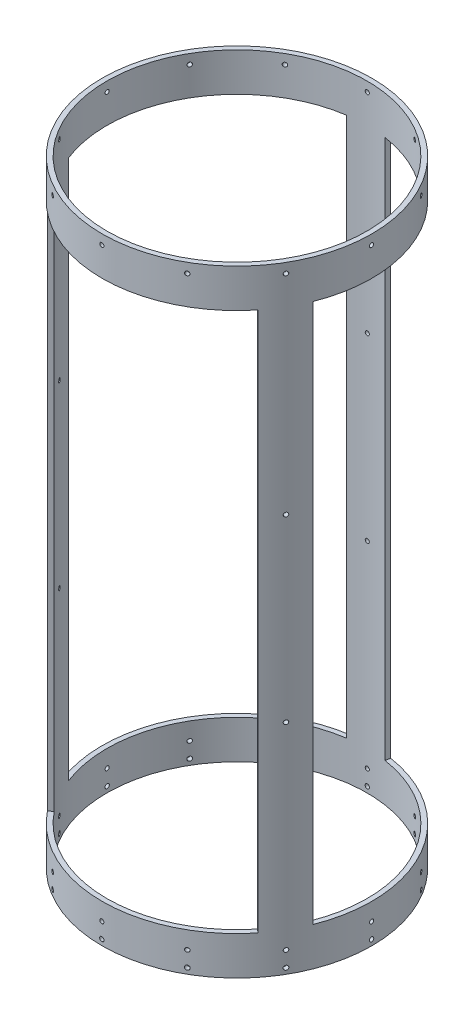
from build123d import *

# Parameters (mm, degrees)
SKETCH1_R               = 88.9
SKETCH1_R_2             = 85.725
BOSS_EXTRUDE1_DEPTH     = 203.2
CUT_EXTRUDE5_START      = -25.4
CUT_EXTRUDE5_DEPTH      = 355.6
CIRPATTERN5_COUNT       = 3
CUT_EXTRUDE2_REACH      = 240.949
CUT_EXTRUDE2_END_RADIUS = 88.9
SKETCH3_R               = 1.4351
SKETCH3_R_2             = 1.35255
CIRPATTERN2_COUNT       = 12
SKETCH4_R               = 1.35255
CUT_EXTRUDE3_DEPTH      = 15.24
CIRPATTERN3_COUNT       = 12
CUT_EXTRUDE4_REACH      = 286.264
SKETCH5_R               = 1.35255
CIRPATTERN4_COUNT       = 3


with BuildPart() as part:
    # Sketch1 → Boss-Extrude1 (new, symmetric)
    with BuildSketch(Plane(origin=(0, 0, 0), x_dir=(1, 0, 0), z_dir=(0, 1, 0))):
        Circle(SKETCH1_R)
        Circle(SKETCH1_R_2, mode=Mode.SUBTRACT)
    extrude(amount=BOSS_EXTRUDE1_DEPTH, both=True)

    # Sketch6 → Cut-Extrude5 (cut)
    with BuildSketch(Plane(origin=(0, -203.2, 0), x_dir=(-1, 0, 0), z_dir=(0, -1, 0)).offset(CUT_EXTRUDE5_START)):
        with BuildLine():
            Line((82.79008563, -32.388450433), (79.833296857, -31.23172006))
            ThreePointArc((79.833296857, -31.23172006), (74.185462692, 42.956870815), (12.653594621, 84.785978606))
            Line((12.653594621, 84.785978606), (13.122246274, 87.926200036))
            ThreePointArc((13.122246274, 87.926200036), (76.933072421, 44.54786603), (82.79008563, -32.388450433))
        make_face()
    cut_extrude5 = extrude(amount=-CUT_EXTRUDE5_DEPTH, mode=Mode.SUBTRACT)

    # CirPattern5: Cut-Extrude5 ×3 about axis
    cirpattern5_axis = Axis((0, -203.2, 0), (0, 1, 0))
    for i in range(1, CIRPATTERN5_COUNT):
        add(cut_extrude5.rotate(cirpattern5_axis, i * 360 / CIRPATTERN5_COUNT), mode=Mode.SUBTRACT)

    # Cut-Extrude2: up to this cylinder (the profile starts inside it)
    cut_extrude2_end = Plane(origin=(0, -194.31, 0), z_dir=(0, -1, 0)) * Cylinder(CUT_EXTRUDE2_END_RADIUS, 670.858, mode=Mode.PRIVATE)
    # Sketch3 → Cut-Extrude2 (cut, up to the surface)
    with BuildSketch(Plane(origin=(0, 0, 0), x_dir=(-1, 0, 0), z_dir=(0, 0, -1)), mode=Mode.PRIVATE) as cut_extrude2_sk1:
        with Locations((-0.169185452, -199.39)):
            Circle(SKETCH3_R)
    cut_extrude2_tool1 = extrude(cut_extrude2_sk1.sketch, amount=CUT_EXTRUDE2_REACH, mode=Mode.PRIVATE) & cut_extrude2_end
    # Sketch3 → Cut-Extrude2 (cut, up to the surface)
    with BuildSketch(Plane(origin=(0, 0, 0), x_dir=(-1, 0, 0), z_dir=(0, 0, -1)), mode=Mode.PRIVATE) as cut_extrude2_sk2:
        with Locations((-0.169185452, -189.23)):
            Circle(SKETCH3_R_2)
    cut_extrude2_tool2 = extrude(cut_extrude2_sk2.sketch, amount=CUT_EXTRUDE2_REACH, mode=Mode.PRIVATE) & cut_extrude2_end
    cut_extrude2 = cut_extrude2_tool1.solids().sort_by_distance((0.169185, -199.39, 0))[0] + cut_extrude2_tool2.solids().sort_by_distance((0.169185, -189.23, 0))[0]
    add(cut_extrude2, mode=Mode.SUBTRACT)

    # CirPattern2: Cut-Extrude2 ×12 about axis
    cirpattern2_axis = Axis((0, 203.2, 0), (0, -1, 0))
    for i in range(1, CIRPATTERN2_COUNT):
        add(cut_extrude2.rotate(cirpattern2_axis, i * 360 / CIRPATTERN2_COUNT), mode=Mode.SUBTRACT)

    # Sketch4 → Cut-Extrude3 (cut)
    with BuildSketch(Plane(origin=(0, 0, -88.9), x_dir=(-1, 0, 0), z_dir=(0, 0, -1))):
        with Locations((-0.169185452, 196.85)):
            Circle(SKETCH4_R)
    cut_extrude3 = extrude(amount=-CUT_EXTRUDE3_DEPTH, mode=Mode.SUBTRACT)

    # CirPattern3: Cut-Extrude3 ×12 about axis
    cirpattern3_axis = Axis((0, 203.2, 0), (0, 1, 0))
    for i in range(1, CIRPATTERN3_COUNT):
        add(cut_extrude3.rotate(cirpattern3_axis, i * 360 / CIRPATTERN3_COUNT), mode=Mode.SUBTRACT)

    # Sketch5 → Cut-Extrude4 (cut, up to next)
    with BuildSketch(Plane.XY.offset(88.9), mode=Mode.PRIVATE) as cut_extrude4_sk1:
        with Locations((0.169185452, 59.266666667)):
            Circle(SKETCH5_R)
    cut_extrude4_tool1 = extrude(cut_extrude4_sk1.sketch, amount=-CUT_EXTRUDE4_REACH, mode=Mode.PRIVATE) & part.part
    # Sketch5 → Cut-Extrude4 (cut, up to next)
    with BuildSketch(Plane.XY.offset(88.9), mode=Mode.PRIVATE) as cut_extrude4_sk2:
        with Locations((0.169185452, -59.266666667)):
            Circle(SKETCH5_R)
    cut_extrude4_tool2 = extrude(cut_extrude4_sk2.sketch, amount=-CUT_EXTRUDE4_REACH, mode=Mode.PRIVATE) & part.part
    cut_extrude4_1 = cut_extrude4_tool1.solids().sort_by_distance((0.169185, 59.266667, 88.9))[0]
    add(cut_extrude4_1, mode=Mode.SUBTRACT)
    cut_extrude4_2 = cut_extrude4_tool2.solids().sort_by_distance((0.169185, -59.266667, 88.9))[0]
    add(cut_extrude4_2, mode=Mode.SUBTRACT)
    cut_extrude4 = cut_extrude4_1 + cut_extrude4_2  # Cut-Extrude4 as one shape, for the pattern or mirror that repeats it

    # CirPattern4: Cut-Extrude4 ×3 about axis
    cirpattern4_axis = Axis((0, 203.2, 0), (0, -1, 0))
    for i in range(1, CIRPATTERN4_COUNT):
        add(cut_extrude4.rotate(cirpattern4_axis, i * 360 / CIRPATTERN4_COUNT), mode=Mode.SUBTRACT)


solid = part.part
